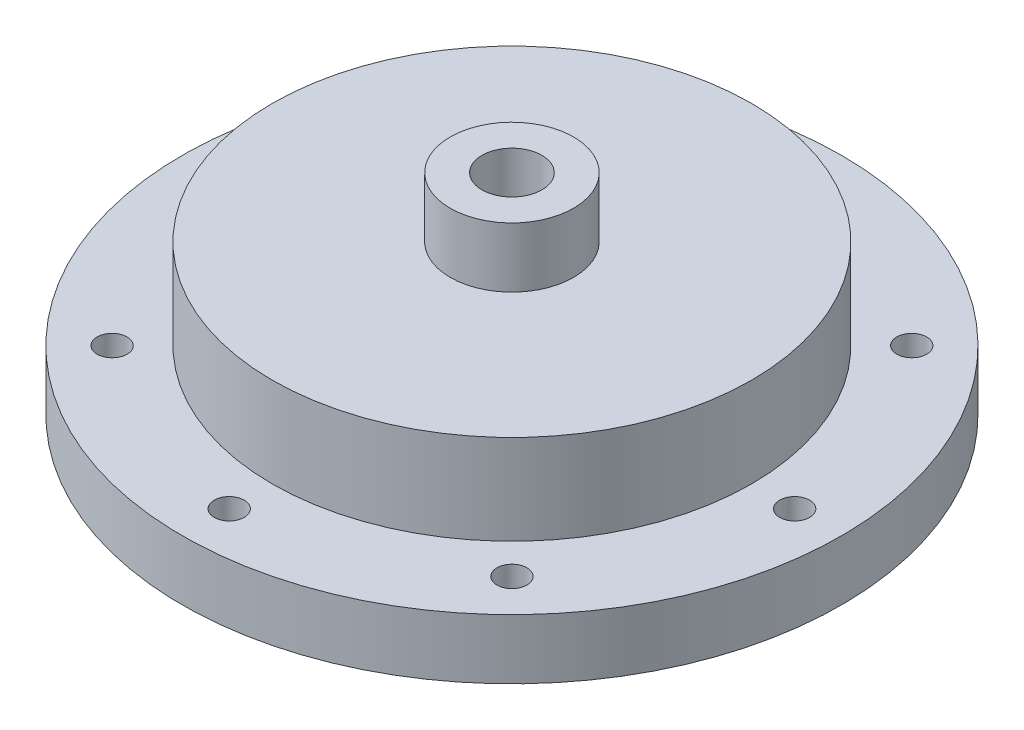
from build123d import *

# Parameters (mm, degrees)
SKETCH1_R           = 50.8
BOSS_EXTRUDE1_DEPTH = 31.75
SKETCH2_R           = 69.85
SKETCH2_R_2         = 50.8
BOSS_EXTRUDE2_DEPTH = 12.7
SKETCH3_R           = 49.53
SKETCH3_R_2         = 47.625
CUT_EXTRUDE1_DEPTH  = 1.1176
CUT_EXTRUDE2_REACH  = 105.76
SKETCH4_R           = 3.175
SKETCH5_R           = 11.43
CUT_EXTRUDE3_DEPTH  = 19.05
CUT_EXTRUDE4_REACH  = 102.603
SKETCH6_R           = 1.5875
CUT_SWEEP8_START    = 1.403690694
CUT_SWEEP8_DEPTH    = 13.66449263
CUT_SWEEP8_START_2  = 0.275893974
CUT_SWEEP8_2_DEPTH  = 13.077597295
CIRPATTERN2_COUNT   = 6
SKETCH34_R          = 13.081
SKETCH34_R_2        = 6.35
BOSS_EXTRUDE3_DEPTH = 12.7


# Read off the part's stored shape, not the designer's step: Cut-Sweep8
with BuildPart() as part:
    # Sketch1 → Boss-Extrude1 (new body)
    with BuildSketch(Plane(origin=(0, 0, 0), x_dir=(1, 0, 0), z_dir=(0, 1, 0))):
        with Locations(Location((0, 0, 0), (0, 0, 270))):
            Circle(SKETCH1_R)
    extrude(amount=BOSS_EXTRUDE1_DEPTH)

    # Sketch2 → Boss-Extrude2 (add)
    with BuildSketch(Plane.XZ):
        with Locations(Location((0, 0, 0), (0, 0, 270))):
            Circle(SKETCH2_R)
        with Locations(Location((0, 0, 0), (0, 0, 270))):
            Circle(SKETCH2_R_2, mode=Mode.SUBTRACT)
    extrude(amount=-BOSS_EXTRUDE2_DEPTH)

    # Sketch3 → Cut-Extrude1 (cut)
    with BuildSketch(Plane.XZ):
        with Locations(Location((0, 0, 0), (0, 0, 270))):
            Circle(SKETCH3_R)
        with Locations(Location((0, 0, 0), (0, 0, 270))):
            Circle(SKETCH3_R_2, mode=Mode.SUBTRACT)
    extrude(amount=-CUT_EXTRUDE1_DEPTH, mode=Mode.SUBTRACT)

    # Sketch4 → Cut-Extrude2 (cut, up to next)
    with BuildSketch(Plane.XZ, mode=Mode.PRIVATE) as cut_extrude2_sk1:
        with Locations(Location((0, -59.9186, 0), (0, 0, 270))):
            Circle(SKETCH4_R)
    cut_extrude2_tool1 = extrude(cut_extrude2_sk1.sketch, amount=-CUT_EXTRUDE2_REACH, mode=Mode.PRIVATE) & part.part
    # Sketch4 → Cut-Extrude2 (cut, up to next)
    with BuildSketch(Plane.XZ, mode=Mode.PRIVATE) as cut_extrude2_sk2:
        with Locations(Location((-42.368848379, -42.368848379, 0), (0, 0, 270))):
            Circle(SKETCH4_R)
    cut_extrude2_tool2 = extrude(cut_extrude2_sk2.sketch, amount=-CUT_EXTRUDE2_REACH, mode=Mode.PRIVATE) & part.part
    # Sketch4 → Cut-Extrude2 (cut, up to next)
    with BuildSketch(Plane.XZ, mode=Mode.PRIVATE) as cut_extrude2_sk3:
        with Locations(Location((-59.9186, 0, 0), (0, 0, 270))):
            Circle(SKETCH4_R)
    cut_extrude2_tool3 = extrude(cut_extrude2_sk3.sketch, amount=-CUT_EXTRUDE2_REACH, mode=Mode.PRIVATE) & part.part
    # Sketch4 → Cut-Extrude2 (cut, up to next)
    with BuildSketch(Plane.XZ, mode=Mode.PRIVATE) as cut_extrude2_sk4:
        with Locations(Location((-42.368848379, 42.368848379, 0), (0, 0, 270))):
            Circle(SKETCH4_R)
    cut_extrude2_tool4 = extrude(cut_extrude2_sk4.sketch, amount=-CUT_EXTRUDE2_REACH, mode=Mode.PRIVATE) & part.part
    # Sketch4 → Cut-Extrude2 (cut, up to next)
    with BuildSketch(Plane.XZ, mode=Mode.PRIVATE) as cut_extrude2_sk5:
        with Locations(Location((0, 59.9186, 0), (0, 0, 270))):
            Circle(SKETCH4_R)
    cut_extrude2_tool5 = extrude(cut_extrude2_sk5.sketch, amount=-CUT_EXTRUDE2_REACH, mode=Mode.PRIVATE) & part.part
    # Sketch4 → Cut-Extrude2 (cut, up to next)
    with BuildSketch(Plane.XZ, mode=Mode.PRIVATE) as cut_extrude2_sk6:
        with Locations(Location((42.368848379, 42.368848379, 0), (0, 0, 270))):
            Circle(SKETCH4_R)
    cut_extrude2_tool6 = extrude(cut_extrude2_sk6.sketch, amount=-CUT_EXTRUDE2_REACH, mode=Mode.PRIVATE) & part.part
    # Sketch4 → Cut-Extrude2 (cut, up to next)
    with BuildSketch(Plane.XZ, mode=Mode.PRIVATE) as cut_extrude2_sk7:
        with Locations(Location((59.9186, 0, 0), (0, 0, 270))):
            Circle(SKETCH4_R)
    cut_extrude2_tool7 = extrude(cut_extrude2_sk7.sketch, amount=-CUT_EXTRUDE2_REACH, mode=Mode.PRIVATE) & part.part
    # Sketch4 → Cut-Extrude2 (cut, up to next)
    with BuildSketch(Plane.XZ, mode=Mode.PRIVATE) as cut_extrude2_sk8:
        with Locations(Location((42.368848379, -42.368848379, 0), (0, 0, 270))):
            Circle(SKETCH4_R)
    cut_extrude2_tool8 = extrude(cut_extrude2_sk8.sketch, amount=-CUT_EXTRUDE2_REACH, mode=Mode.PRIVATE) & part.part
    add(cut_extrude2_tool1.solids().sort_by_distance((0, 0, -59.9186))[0], mode=Mode.SUBTRACT)
    add(cut_extrude2_tool2.solids().sort_by_distance((-42.368848, 0, -42.368848))[0], mode=Mode.SUBTRACT)
    add(cut_extrude2_tool3.solids().sort_by_distance((-59.9186, 0, 0))[0], mode=Mode.SUBTRACT)
    add(cut_extrude2_tool4.solids().sort_by_distance((-42.368848, 0, 42.368848))[0], mode=Mode.SUBTRACT)
    add(cut_extrude2_tool5.solids().sort_by_distance((0, 0, 59.9186))[0], mode=Mode.SUBTRACT)
    add(cut_extrude2_tool6.solids().sort_by_distance((42.368848, 0, 42.368848))[0], mode=Mode.SUBTRACT)
    add(cut_extrude2_tool7.solids().sort_by_distance((59.9186, 0, 0))[0], mode=Mode.SUBTRACT)
    add(cut_extrude2_tool8.solids().sort_by_distance((42.368848, 0, -42.368848))[0], mode=Mode.SUBTRACT)

    # Sketch5 → Cut-Extrude3 (cut)
    with BuildSketch(Plane(origin=(0, 31.75, 0), x_dir=(1, 0, 0), z_dir=(0, 1, 0))):
        with Locations(Location((0, 0, 0), (0, 0, 270))):
            Circle(SKETCH5_R)
    extrude(amount=-CUT_EXTRUDE3_DEPTH, mode=Mode.SUBTRACT)

    # Sketch6 → Cut-Extrude4 (cut, up to next)
    with BuildSketch(Plane(origin=(0, 12.7, 0), x_dir=(1, 0, 0), z_dir=(0, 1, 0)), mode=Mode.PRIVATE) as cut_extrude4_sk1:
        with Locations(Location((0, 0, 0), (0, 0, 270))):
            Circle(SKETCH6_R)
    cut_extrude4_tool1 = extrude(cut_extrude4_sk1.sketch, amount=-CUT_EXTRUDE4_REACH, mode=Mode.PRIVATE) & part.part
    add(cut_extrude4_tool1.solids().sort_by_distance((0, 12.7, 0))[0], mode=Mode.SUBTRACT)

    # Cut-Sweep8 outline → Cut-Sweep8 (cut)
    with BuildSketch(Plane(origin=(0, 0, 0), x_dir=(1, 0, 0), z_dir=(0, 0.9703120732527684, -0.24185632201766868)).offset(CUT_SWEEP8_START)):
        with BuildLine():
            add(Edge.make_bspline(
                [(0, 5.631517562), (2.38125, 5.631517562), (2.38125, 7.942073187), (0, 7.942073187), (-2.38125, 7.942073187), (-2.38125, 5.631517562), (0, 5.631517562)],
                knots=[0, 0, 0, 0, 0.5, 0.5, 0.5, 1, 1, 1, 1], degree=3, weights=[1, 0.333333333, 0.333333333, 1, 0.333333333, 0.333333333, 1]))
        make_face()
    cut_sweep8 = extrude(amount=CUT_SWEEP8_DEPTH, mode=Mode.SUBTRACT)

    # Cut-Sweep8 2 outline → Cut-Sweep8 2 (cut)
    with BuildSketch(Plane(origin=(0, 0, 0), x_dir=(1, 0, 0), z_dir=(0, 0.9925921043162648, -0.12149450378107311)).offset(CUT_SWEEP8_START_2)):
        with BuildLine():
            add(Edge.make_bspline(
                [(0, 4.564567797), (2.38125, 4.564567797), (2.38125, 2.254012172), (0, 2.254012172), (-2.38125, 2.254012172), (-2.38125, 4.564567797), (0, 4.564567797)],
                knots=[0, 0, 0, 0, 0.5, 0.5, 0.5, 1, 1, 1, 1], degree=3, weights=[1, 0.333333333, 0.333333333, 1, 0.333333333, 0.333333333, 1]))
        make_face()
    cut_sweep8_2 = extrude(amount=CUT_SWEEP8_2_DEPTH, mode=Mode.SUBTRACT)

    # CirPattern2: Cut-Sweep8, Cut-Sweep8 2 ×6 about axis
    cirpattern2_axis = Axis((0, -28.061269261, 0), (0, 1, 0))
    add([cut_sweep8.rotate(cirpattern2_axis, i * 360 / CIRPATTERN2_COUNT) for i in range(1, CIRPATTERN2_COUNT)], mode=Mode.SUBTRACT)
    add([cut_sweep8_2.rotate(cirpattern2_axis, i * 360 / CIRPATTERN2_COUNT) for i in range(1, CIRPATTERN2_COUNT)], mode=Mode.SUBTRACT)

    # Sketch34 → Boss-Extrude3 (add)
    with BuildSketch(Plane(origin=(0, 31.75, 0), x_dir=(1, 0, 0), z_dir=(0, 1, 0))):
        with Locations(Location((0, 0, 0), (0, 0, 270))):
            Circle(SKETCH34_R)
        with Locations(Location((0, 0, 0), (0, 0, 270))):
            Circle(SKETCH34_R_2, mode=Mode.SUBTRACT)
    extrude(amount=BOSS_EXTRUDE3_DEPTH)


solid = part.part
